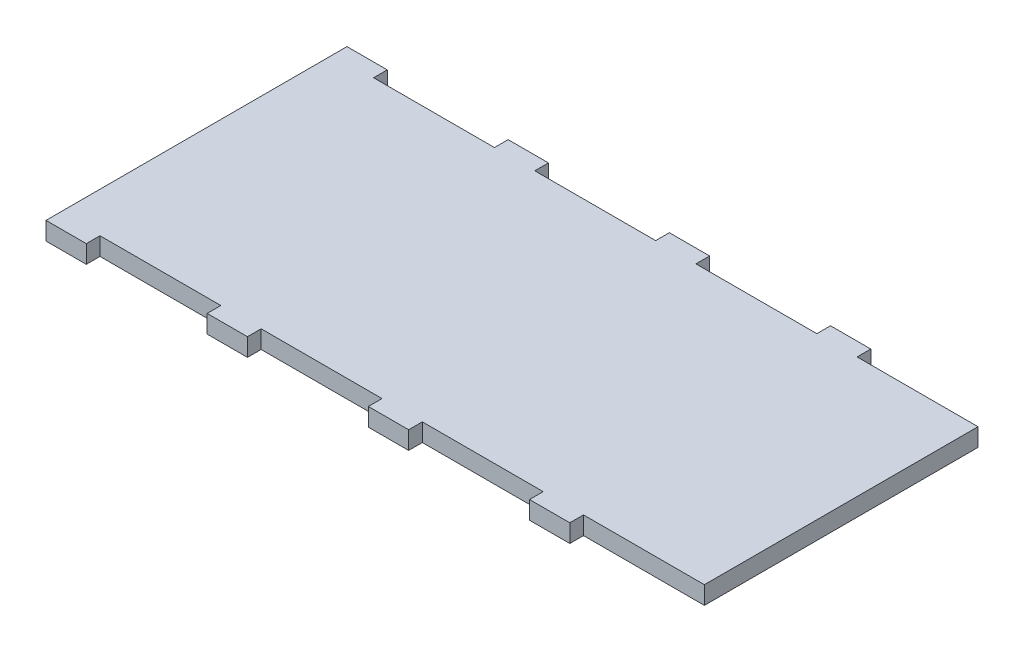
from build123d import *

# Parameters (mm, degrees)
SKETCH1_W                  = 359.0798
SKETCH1_H                  = 152.4
BOSS_EXTRUDE1_DEPTH        = 2.54
SKETCH2_W                  = 22.4424875
SKETCH2_H                  = 7.62
BOSS_EXTRUDE2_DEPTH        = 2.54
CONVERT_SOLID1_OUTLINE_W   = 7.46
CONVERT_SOLID1_OUTLINE_H   = 152.4
CONVERT_SOLID1_DEPTH       = 359.0798
CONVERT_SOLID1_2_OUTLINE_W = 7.46
CONVERT_SOLID1_2_OUTLINE_H = 7.62
CONVERT_SOLID1_2_DEPTH     = 22.4424875
CONVERT_SOLID1_START       = 89.76995
CONVERT_SOLID1_3_OUTLINE_W = 7.46
CONVERT_SOLID1_3_OUTLINE_H = 7.62
CONVERT_SOLID1_3_DEPTH     = 22.4424875
CONVERT_SOLID1_START_2     = 179.5399
CONVERT_SOLID1_4_OUTLINE_W = 7.46
CONVERT_SOLID1_4_OUTLINE_H = 7.62
CONVERT_SOLID1_4_DEPTH     = 22.4424875
CONVERT_SOLID1_START_3     = 269.30985
CONVERT_SOLID1_5_OUTLINE_W = 7.46
CONVERT_SOLID1_5_OUTLINE_H = 7.62
CONVERT_SOLID1_5_DEPTH     = 22.4424875


# Read off the part's stored shape, not the designer's step: Convert-Solid1
with BuildPart() as part:
    # Sketch1 → Boss-Extrude1 (new body)
    with BuildSketch(Plane(origin=(0, 0, 0), x_dir=(1, 0, 0), z_dir=(0, 1, 0))):
        with Locations((179.5399, 76.2)):
            Rectangle(SKETCH1_W, SKETCH1_H)
    extrude(amount=BOSS_EXTRUDE1_DEPTH)

    # Sketch2 → Boss-Extrude2 (add)
    with BuildSketch(Plane(origin=(0, 2.54, 0), x_dir=(1, 0, 0), z_dir=(0, 1, 0))):
        with Locations((11.22124375, 156.21)):
            Rectangle(SKETCH2_W, SKETCH2_H)
        with Locations((100.99119375, 156.21)):
            Rectangle(SKETCH2_W, SKETCH2_H)
        with Locations((190.76114375, 156.21)):
            Rectangle(SKETCH2_W, SKETCH2_H)
        with Locations((280.53109375, 156.21)):
            Rectangle(SKETCH2_W, SKETCH2_H)
        with Locations((11.22124375, -3.81)):
            Rectangle(SKETCH2_W, SKETCH2_H)
        with Locations((100.99119375, -3.81)):
            Rectangle(SKETCH2_W, SKETCH2_H)
        with Locations((190.76114375, -3.81)):
            Rectangle(SKETCH2_W, SKETCH2_H)
        with Locations((280.53109375, -3.81)):
            Rectangle(SKETCH2_W, SKETCH2_H)
    extrude(amount=-BOSS_EXTRUDE2_DEPTH)

    # Convert-Solid1 outline → Convert-Solid1 (add)
    with BuildSketch(Plane.YZ):
        with Locations((-3.73, -76.2)):
            Rectangle(CONVERT_SOLID1_OUTLINE_W, CONVERT_SOLID1_OUTLINE_H)
    extrude(amount=CONVERT_SOLID1_DEPTH)

    # Convert-Solid1 2 outline → Convert-Solid1 2 (add)
    with BuildSketch(Plane.YZ):
        with Locations((-3.73, 3.81)):
            Rectangle(CONVERT_SOLID1_2_OUTLINE_W, CONVERT_SOLID1_2_OUTLINE_H)
        with Locations((-3.73, -156.21)):
            Rectangle(CONVERT_SOLID1_2_OUTLINE_W, CONVERT_SOLID1_2_OUTLINE_H)
    extrude(amount=CONVERT_SOLID1_2_DEPTH)

    # Convert-Solid1 3 outline → Convert-Solid1 3 (add)
    with BuildSketch(Plane.YZ.offset(CONVERT_SOLID1_START)):
        with Locations((-3.73, 3.81)):
            Rectangle(CONVERT_SOLID1_3_OUTLINE_W, CONVERT_SOLID1_3_OUTLINE_H)
        with Locations((-3.73, -156.21)):
            Rectangle(CONVERT_SOLID1_3_OUTLINE_W, CONVERT_SOLID1_3_OUTLINE_H)
    extrude(amount=CONVERT_SOLID1_3_DEPTH)

    # Convert-Solid1 4 outline → Convert-Solid1 4 (add)
    with BuildSketch(Plane.YZ.offset(CONVERT_SOLID1_START_2)):
        with Locations((-3.73, 3.81)):
            Rectangle(CONVERT_SOLID1_4_OUTLINE_W, CONVERT_SOLID1_4_OUTLINE_H)
        with Locations((-3.73, -156.21)):
            Rectangle(CONVERT_SOLID1_4_OUTLINE_W, CONVERT_SOLID1_4_OUTLINE_H)
    extrude(amount=CONVERT_SOLID1_4_DEPTH)

    # Convert-Solid1 5 outline → Convert-Solid1 5 (add)
    with BuildSketch(Plane.YZ.offset(CONVERT_SOLID1_START_3)):
        with Locations((-3.73, 3.81)):
            Rectangle(CONVERT_SOLID1_5_OUTLINE_W, CONVERT_SOLID1_5_OUTLINE_H)
        with Locations((-3.73, -156.21)):
            Rectangle(CONVERT_SOLID1_5_OUTLINE_W, CONVERT_SOLID1_5_OUTLINE_H)
    extrude(amount=CONVERT_SOLID1_5_DEPTH)


solid = part.part
